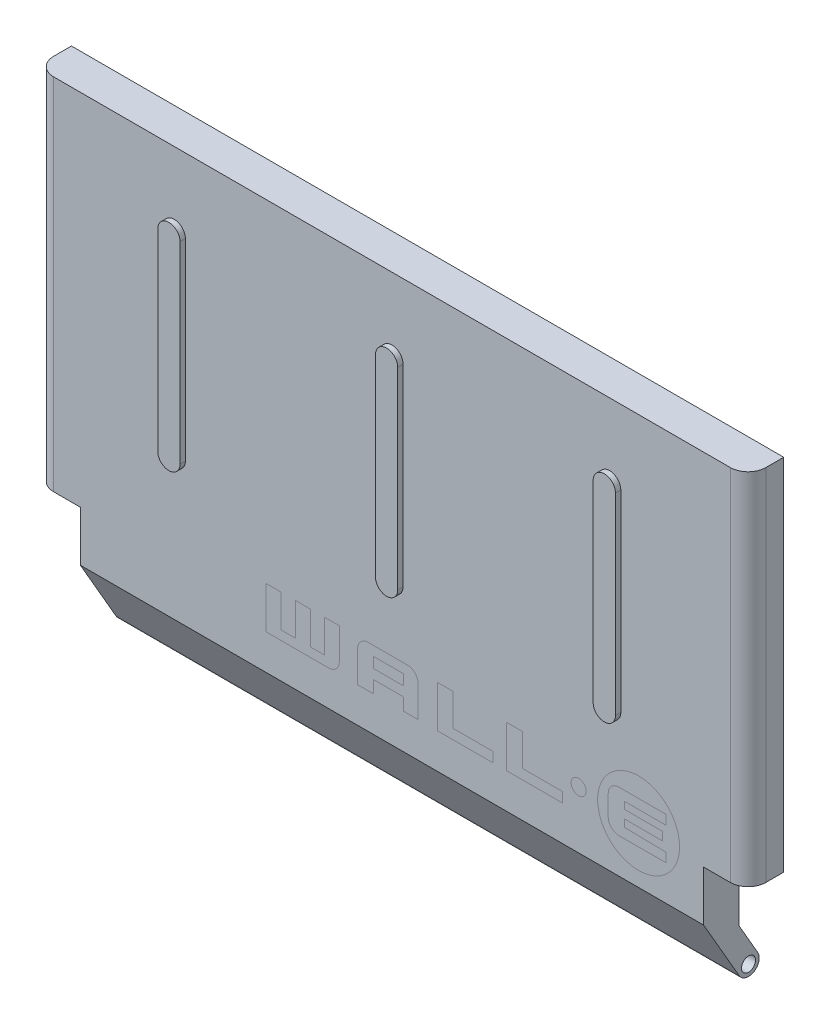
from build123d import *

# Parameters (mm, degrees)
EXTRUDE1_DEPTH = 5.08
FILLET1_R      = 2.54
CHAMFER1_SIZE2 = 5.08
CHAMFER1_SIZE  = 8.798818102
EXTRUDE3_DEPTH = 88.9
SKETCH2_R      = 1.003990475
EXTRUDE2_DEPTH = 196.607873206
EXTRUDE4_DEPTH = 0.762


with BuildPart() as part:
    # Sketch1 → Extrude1 (new body)
    with BuildSketch(Plane.XY):
        Polygon((-49.690313901, -102.787097767), (51.909686099, -102.787097767), (51.909686099, -154.045409896), (45.559686099, -154.045409896), (45.559686099, -170.008151162), (-43.340313901, -170.008151162), (-43.340313901, -154.045409896), (-49.690313901, -154.045409896), align=None)
    extrude(amount=EXTRUDE1_DEPTH)

    # Fillet1
    fillet1_edges = [part.edges().sort_by_distance(p)[0] for p in [
        (51.909686099, -128.416253832, 5.08),
        (-49.690313901, -128.416253832, 5.08),
    ]]
    fillet(fillet1_edges, radius=FILLET1_R)

    # Chamfer1
    chamfer1_edges = [part.edges().sort_by_distance(p)[0] for p in [
        (1.109686099, -170.008151162, 5.08),
    ]]
    chamfer1_side = [part.faces().sort_by_distance(p)[0] for p in [
        (1.109686099, -169.906551162, 5.08),
    ]]
    chamfer(chamfer1_edges, length=CHAMFER1_SIZE - 0.0001, length2=CHAMFER1_SIZE2 - 0.0001, reference=chamfer1_side[0])  # a hair under: the kernel refuses the full size

    # Sketch3 → Extrude3 (add)
    with BuildSketch(Plane(origin=(45.559686099, 0, 0), x_dir=(0, 0, -1), z_dir=(1, 0, 0))):
        with BuildLine():
            Line((-2.656143456, -165.407575745), (0, -170.008151162))
            ThreePointArc((0, -170.008151162), (2.094834297, -170.56946032), (2.656143456, -168.474626023))
            Line((2.656143456, -168.474626023), (0, -163.874050605))
            Line((0, -163.874050605), (-2.656143456, -165.407575745))
        make_face()
    extrude(amount=-EXTRUDE3_DEPTH)

    # Sketch2 → Extrude2 (cut, through all)
    with BuildSketch(Plane(origin=(45.559686099, 0, 0), x_dir=(0, 0, -1), z_dir=(1, 0, 0))):
        with Locations((1.328071728, -169.241388592)):
            Circle(SKETCH2_R)
    extrude(amount=-EXTRUDE2_DEPTH, mode=Mode.SUBTRACT)

    # Sketch4 → Extrude4 (add)
    with BuildSketch(Plane.XY.offset(5.08)):
        with BuildLine():
            Line((2.697186099, -113.368491021), (2.697186099, -140.858908158))
            ThreePointArc((2.697186099, -140.858908158), (1.109686099, -142.446408158), (-0.477813901, -140.858908158))
            Line((-0.477813901, -140.858908158), (-0.477813901, -113.368491021))
            ThreePointArc((-0.477813901, -113.368491021), (1.109686099, -111.780991021), (2.697186099, -113.368491021))
        make_face()
        with BuildLine():
            Line((-31.531803629, -113.368491021), (-31.531803629, -140.858908158))
            ThreePointArc((-31.531803629, -140.858908158), (-29.944303629, -142.446408158), (-28.356803629, -140.858908158))
            Line((-28.356803629, -140.858908158), (-28.356803629, -113.368491021))
            ThreePointArc((-28.356803629, -113.368491021), (-29.944303629, -111.780991021), (-31.531803629, -113.368491021))
        make_face()
        with BuildLine():
            Line((33.751175827, -113.368491021), (33.751175827, -140.858908158))
            ThreePointArc((33.751175827, -140.858908158), (32.163675827, -142.446408158), (30.576175827, -140.858908158))
            Line((30.576175827, -140.858908158), (30.576175827, -113.368491021))
            ThreePointArc((30.576175827, -113.368491021), (32.163675827, -111.780991021), (33.751175827, -113.368491021))
        make_face()
    extrude(amount=EXTRUDE4_DEPTH)


solid = part.part
